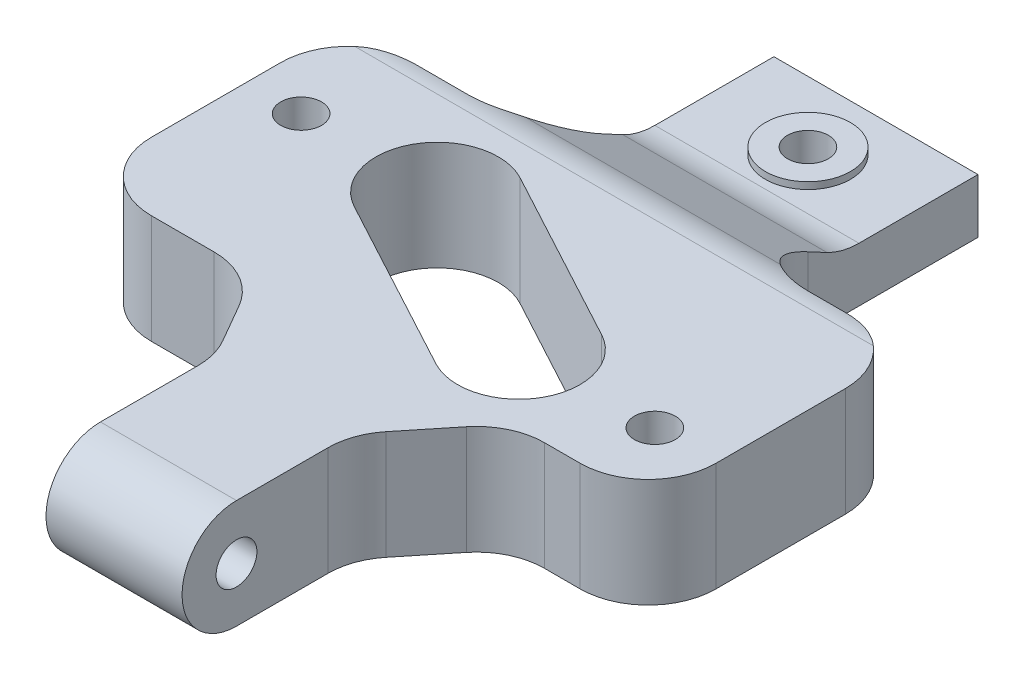
from build123d import *

# Parameters (mm, degrees)
SKETCH_1_R          = 3
EXTRUDE_1_DEPTH     = 16
SKETCH_5_W          = 20
SKETCH_5_H          = 8
REVOLVE_1_ANGLE     = 180
SKETCH_6_R          = 3
CUT_EXTRUDE_4_DEPTH = 20
CUT_EXTRUDE_3_DEPTH = 30
SKETCH_7_R          = 3
CUT_EXTRUDE_5_DEPTH = 85.118812266
EXTRUDE_START       = 1
SKETCH_9_R          = 6.25
SKETCH_9_R_2        = 3
EXTRUDE_2_DEPTH     = 1
FILLET_1_R          = 10
FILLET_START        = -52
FILLET_2_DEPTH      = 79
FILLET_START_2      = -26.5
FILLET_2_2_DEPTH    = 30


with BuildPart() as part:
    # 草图1 → 凸台-拉伸1 (new body)
    with BuildSketch(Plane(origin=(0, 0, 0), x_dir=(1, 0, 0), z_dir=(0, 1, 0))):
        Polygon((-54, -10.000198617), (-29, -10.000198617), (-21.5, -23), (-21.5, -40), (-1.5, -40), (-1.5, -23), (9, -10.000198617), (29, -10.000198617), (29, 28.999801383), (3.5, 28.999801383), (3.5, 63.999801383), (-26.5, 63.999801383), (-26.5, 28.999801383), (-54, 28.999801383), align=None)
        with Locations(Location((-46, 14, 0), (0, 0, 270))):
            Circle(SKETCH_1_R, mode=Mode.SUBTRACT)
        with Locations(Location((20, 0, 0), (0, 0, 270))):
            Circle(SKETCH_1_R, mode=Mode.SUBTRACT)
        with BuildLine():
            Line((-30.266898407, 6.075760101), (-4.266898407, -7.924239899))
            ThreePointArc((-4.266898407, -7.924239899), (7.924239899, -4.266898407), (4.266898407, 7.924239899))
            Line((4.266898407, 7.924239899), (-21.733101593, 21.924239899))
            ThreePointArc((-21.733101593, 21.924239899), (-33.924239899, 18.266898407), (-30.266898407, 6.075760101))
        make_face(mode=Mode.SUBTRACT)
    extrude(amount=EXTRUDE_1_DEPTH)

    # 草图5 → 旋转1 (revolve)
    with BuildSketch(Plane.XY.offset(40)):
        with Locations((-11.5, 12)):
            Rectangle(SKETCH_5_W, SKETCH_5_H)
    revolve(axis=Axis((-21.5, 8, 40), (1, 0, 0)), revolution_arc=REVOLVE_1_ANGLE)

    # 草图6 → 切除-拉伸4 (cut)
    with BuildSketch(Plane(origin=(-1.5, 0, 0), x_dir=(0, 0, -1), z_dir=(1, 0, 0))):
        with Locations((-40, 8)):
            Circle(SKETCH_6_R)
    extrude(amount=-CUT_EXTRUDE_4_DEPTH, mode=Mode.SUBTRACT)

    # 草图4 → 切除-拉伸3 (cut)
    with BuildSketch(Plane(origin=(3.5, 0, 0), x_dir=(0, 0, -1), z_dir=(1, 0, 0))):
        Polygon((28.999801383, 16), (63.999801383, 16), (63.999801383, 8), (43.999801383, 8), align=None)
    extrude(amount=-CUT_EXTRUDE_3_DEPTH, mode=Mode.SUBTRACT)

    # 草图7 → 切除-拉伸5 (cut, through all)
    with BuildSketch(Plane(origin=(0, 8, 0), x_dir=(1, 0, 0), z_dir=(0, 1, 0))):
        with Locations(Location((-11.5, 53.999801383, 0), (0, 0, 270))):
            Circle(SKETCH_7_R)
    extrude(amount=-CUT_EXTRUDE_5_DEPTH, mode=Mode.SUBTRACT)

    # 草图9 → 凸台-拉伸2 (add)
    with BuildSketch(Plane(origin=(0, 8, 0), x_dir=(1, 0, 0), z_dir=(0, 1, 0)).offset(EXTRUDE_START)):
        with Locations(Location((-11.5, 53.999801383, 0), (0, 0, 90))):
            Circle(SKETCH_9_R)
        with Locations(Location((-11.5, 53.999801383, 0), (0, 0, 270))):
            Circle(SKETCH_9_R_2, mode=Mode.SUBTRACT)
    extrude(amount=-EXTRUDE_2_DEPTH)

    # 圆角1
    fillet_1_edges = [part.edges().sort_by_distance(p)[0] for p in [
        (-21.5, 8, 23),
        (-29, 8, 10.000198617),
        (-54, 8, 10.000198617),
        (-54, 8, -28.999801383),
        (-26.5, 8, -28.999801383),
        (3.5, 8, -28.999801383),
        (29, 8, -28.999801383),
        (29, 8, 10.000198617),
        (9, 8, 10.000198617),
        (-1.5, 8, 23),
    ]]
    fillet(fillet_1_edges, radius=FILLET_1_R)

    # 圆角2: read off the stored shape, not the designer's step
    # 圆角2 outline → 圆角2 (cut)
    with BuildSketch(Plane.YZ.offset(FILLET_START)):
        with BuildLine():
            Line((14.823529412, -31.205683736), (16, -28.999801383))
            Line((16, -28.999801383), (16, -26.499801383))
            ThreePointArc((16, -26.499801383), (15.701425001, -28.925157633), (14.823529412, -31.205683736))
        make_face()
    extrude(amount=FILLET_2_DEPTH, mode=Mode.SUBTRACT)

    # Fillet 2 2 outline → Fillet 2 2 (add)
    with BuildSketch(Plane.YZ.offset(FILLET_START_2)):
        with BuildLine():
            Line((8, -43.999801383), (8, -46.499801383))
            ThreePointArc((8, -46.499801383), (8.298574999, -44.074445133), (9.176470588, -41.79391903))
            Line((9.176470588, -41.79391903), (8, -43.999801383))
        make_face()
    extrude(amount=FILLET_2_2_DEPTH)


solid = part.part
